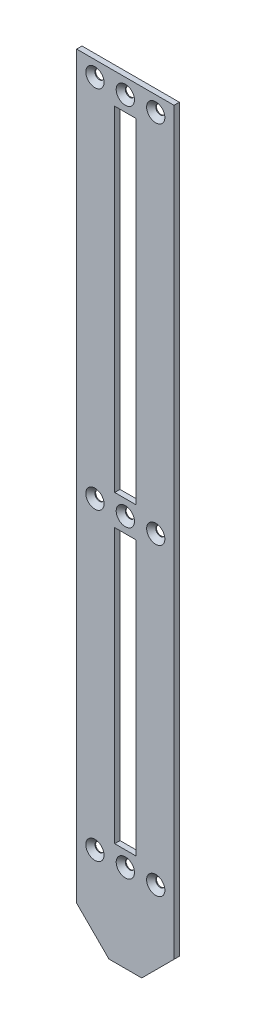
from build123d import *

# Parameters (mm, degrees)
BASE_FLANGE1_START       = -1.755
BASE_FLANGE1_OUTLINE_W   = 14
BASE_FLANGE1_OUTLINE_H   = 180
BASE_FLANGE1_OUTLINE_H_2 = 220
BASE_FLANGE1_DEPTH       = 3.51
SKETCH2_R                = 3
CUT_EXTRUDE2_DEPTH       = 10
CHAMFER1_SIZE            = 3


# Read off the part's stored shape, not the designer's step: Base-Flange1
with BuildPart() as part:
    # Base-Flange1 outline → Base-Flange1 (new body)
    with BuildSketch(Plane.XY.offset(BASE_FLANGE1_START)):
        Polygon((10.786796564, -44.407529677), (32, -23.194326241), (32, 463.194326241), (-32, 463.194326241), (-32, -23.194326241), (-10.786796564, -44.407529677), align=None)
        with Locations((0, 113.194326241)):
            Rectangle(BASE_FLANGE1_OUTLINE_W, BASE_FLANGE1_OUTLINE_H, mode=Mode.SUBTRACT)
        with Locations((0, 333.194326241)):
            Rectangle(BASE_FLANGE1_OUTLINE_W, BASE_FLANGE1_OUTLINE_H_2, mode=Mode.SUBTRACT)
    extrude(amount=BASE_FLANGE1_DEPTH)

    # Sketch2 → Cut-Extrude2 (cut)
    with BuildSketch(Plane.XY.offset(1.755)):
        with Locations((-20, 213.194326241)):
            Circle(SKETCH2_R)
        with Locations((0, 213.194326241)):
            Circle(SKETCH2_R)
        with Locations((20, 213.194326241)):
            Circle(SKETCH2_R)
        with Locations((0, 453.194326241)):
            Circle(SKETCH2_R)
        with Locations((20, 453.194326241)):
            Circle(SKETCH2_R)
        with Locations((-20, 453.194326241)):
            Circle(SKETCH2_R)
        with Locations((0, 13.194326241)):
            Circle(SKETCH2_R)
        with Locations((20, 13.194326241)):
            Circle(SKETCH2_R)
        with Locations((-20, 13.194326241)):
            Circle(SKETCH2_R)
    extrude(amount=-CUT_EXTRUDE2_DEPTH, mode=Mode.SUBTRACT)

    # Chamfer1
    chamfer1_edges = [part.edges().sort_by_distance(p)[0] for p in [
        (-3, 453.194326241, 1.755),
        (17, 453.194326241, 1.755),
        (-23, 13.194326241, 1.755),
        (17, 13.194326241, 1.755),
        (-3, 13.194326241, 1.755),
        (-23, 453.194326241, 1.755),
        (-23, 213.194326241, 1.755),
        (-3, 213.194326241, 1.755),
        (17, 213.194326241, 1.755),
    ]]
    chamfer(chamfer1_edges, length=CHAMFER1_SIZE)


solid = part.part
